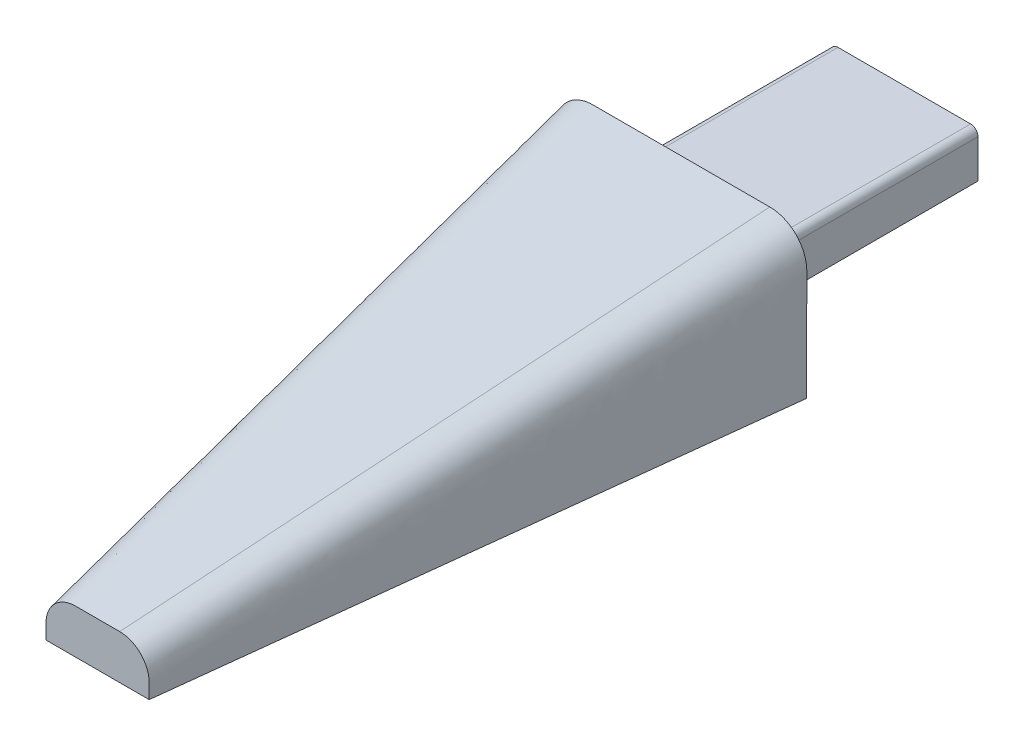
from build123d import *

# Parameters (mm, degrees)
SKETCH1_W           = 10
SKETCH1_H           = 3.105775443
BOSS_EXTRUDE1_DEPTH = 15.14
FILLET1_R           = 0.5


with BuildPart() as part:
    # Sketch1 → Boss-Extrude1 (new body)
    with BuildSketch(Plane.XY):
        with Locations((-0.008293574, -2.2925e-05)):
            Rectangle(SKETCH1_W, SKETCH1_H)
    extrude(amount=BOSS_EXTRUDE1_DEPTH)

    # Loft1: read off the stored shape, not the designer's step
    # Loft1: loft between two sections, ruled curve by curve
    loft1_from = [
        Edge.make_bspline([(6.002368105, 5, 15.14), (4.973125798, 5, 15.14), (3.004819926, 5, 15.14), (0.185859297, 5, 15.14), (-2.58508535, 5, 15.14), (-4.44969412, 5, 15.14), (-5.449891462, 5, 15.14), (-5.57771544, 5, 15.14), (-5.783318565, 5, 15.14), (-5.907849178, 5, 15.14), (-5.972093141, 5, 15.14), (-6.17467612, 5, 15.14), (-6.499597583, 4.964301348, 15.14), (-6.934896014, 4.832707278, 15.14), (-7.32552261, 4.634429877, 15.14), (-7.673911431, 4.373864242, 15.14), (-7.978763997, 4.050324082, 15.14), (-8.234306918, 3.655920908, 15.14), (-8.396723796, 3.254240148, 15.14), (-8.480332717, 2.862623296, 15.14), (-8.5, 2.631885527, 15.14), (-8.5, 2.075292876, 15.14), (-8.5, 1.127457579, 15.14), (-8.5, -0.819864409, 15.14), (-8.5, -3.191164425, 15.14), (-8.5, -4.454054832, 15.14), (-8.5, -5, 15.14)], [0, 0, 0, 0, 0.111510841, 0.223021681, 0.334532522, 0.446043363, 0.446043363, 0.451912354, 0.457781346, 0.463650337, 0.469519329, 0.469519329, 0.506254839, 0.54299035, 0.57972586, 0.61646137, 0.653196881, 0.689932391, 0.726667901, 0.745035656, 0.763403412, 0.763403412, 0.822552559, 0.881701706, 0.940850853, 1, 1, 1, 1], 3),
        Edge.make_bspline([(8.5, -5, 15.14), (8.500991996, -4.575244993, 15.14), (8.503176578, -3.63984652, 15.14), (8.508751194, -1.252896386, 15.14), (8.51432581, 1.134053748, 15.14), (8.516510392, 2.069452221, 15.14), (8.517811111, 2.626396957, 15.14), (8.49908527, 2.846946207, 15.14), (8.443489244, 3.123561182, 15.14), (8.367638554, 3.363722111, 15.14), (8.245865367, 3.65118142, 15.14), (8.059926267, 3.961930691, 15.14), (7.790063704, 4.279208373, 15.14), (7.471784056, 4.547888472, 15.14), (7.160345054, 4.732669981, 15.14), (6.872434615, 4.853372684, 15.14), (6.631993106, 4.928329205, 15.14), (6.355173173, 4.982895557, 15.14), (6.13455577, 5.000800601, 15.14), (6.002368105, 5, 15.14)], [0, 0, 0, 0, 0.111365706, 0.222731413, 0.334097119, 0.445462826, 0.445462826, 0.480121399, 0.514779973, 0.549438546, 0.584097119, 0.653414266, 0.722731413, 0.79204856, 0.861365706, 0.89602428, 0.930682853, 0.965341427, 1, 1, 1, 1], 3),
        Edge.make_line((-8.5, -5, 15.14), (8.5, -5, 15.14)),
    ]
    loft1_to = [
        Edge.make_bspline([(1.898763427, -2, 55.14), (1.68912791, -2, 55.14), (1.247791237, -2, 55.14), (0.527731018, -2, 55.14), (-0.222420428, -2, 55.14), (-0.713736573, -2, 55.14), (-0.963736573, -2, 55.14), (-0.986728567, -2, 55.14), (-1.019071695, -2, 55.14), (-1.054765163, -2, 55.14), (-1.080945918, -2, 55.14), (-1.228240938, -2, 55.14), (-1.496918662, -2.025435314, 55.14), (-1.911785618, -2.15285696, 55.14), (-2.306346344, -2.382510015, 55.14), (-2.62960532, -2.68644458, 55.14), (-2.864851797, -3.028969372, 55.14), (-3.011847525, -3.375243405, 55.14), (-3.075118823, -3.64816943, 55.14), (-3.0978707, -3.853987875, 55.14), (-3.101236573, -3.952199478, 55.14), (-3.101236573, -4.153930631, 55.14), (-3.101236573, -4.297062563, 55.14), (-3.101236573, -4.527630405, 55.14), (-3.101236573, -4.731947482, 55.14), (-3.101236573, -4.888802183, 55.14), (-3.101236573, -5, 55.14)], [0, 0, 0, 0, 0.111510841, 0.223021681, 0.334532522, 0.446043363, 0.446043363, 0.451912354, 0.457781346, 0.463650337, 0.469519329, 0.469519329, 0.506254839, 0.54299035, 0.57972586, 0.61646137, 0.653196881, 0.689932391, 0.726667901, 0.745035656, 0.763403412, 0.763403412, 0.822552559, 0.881701706, 0.940850853, 1, 1, 1, 1], 3),
        Edge.make_bspline([(3.898763427, -5, 55.14), (3.898763427, -4.846256203, 55.14), (3.898763427, -4.714582876, 55.14), (3.898763427, -4.5, 55.14), (3.898763427, -4.285417124, 55.14), (3.898763427, -4.153743797, 55.14), (3.898763427, -3.952152769, 55.14), (3.895391319, -3.852913488, 55.14), (3.877383526, -3.693016744, 55.14), (3.843592793, -3.521678819, 55.14), (3.772300297, -3.279550251, 55.14), (3.62424883, -2.954199991, 55.14), (3.327418957, -2.571379789, 55.14), (2.944616956, -2.274539085, 55.14), (2.619245408, -2.126493121, 55.14), (2.377114625, -2.05518085, 55.14), (2.20577222, -2.021376458, 55.14), (2.045857954, -2.003369443, 55.14), (1.946610658, -2, 55.14), (1.898763427, -2, 55.14)], [0, 0, 0, 0, 0.111365706, 0.222731413, 0.334097119, 0.445462826, 0.445462826, 0.480121399, 0.514779973, 0.549438546, 0.584097119, 0.653414266, 0.722731413, 0.79204856, 0.861365706, 0.89602428, 0.930682853, 0.965341427, 1, 1, 1, 1], 3),
        Edge.make_line((-3.101236573, -5, 55.14), (3.898763427, -5, 55.14)),
    ]
    loft1 = Solid(Shell([*[Face.make_surface_from_curves(loft1_from[k], loft1_to[k]) for k in range(3)], Face(Wire(loft1_from)), Face(Wire(loft1_to))]))
    add(loft1)

    # Fillet1
    fillet1_edges = [part.edges().sort_by_distance(p)[0] for p in [
        (-5.008293574, 1.552864796, 7.57),
        (4.991706426, 1.552864796, 7.57),
    ]]
    fillet(fillet1_edges, radius=FILLET1_R)


solid = part.part
